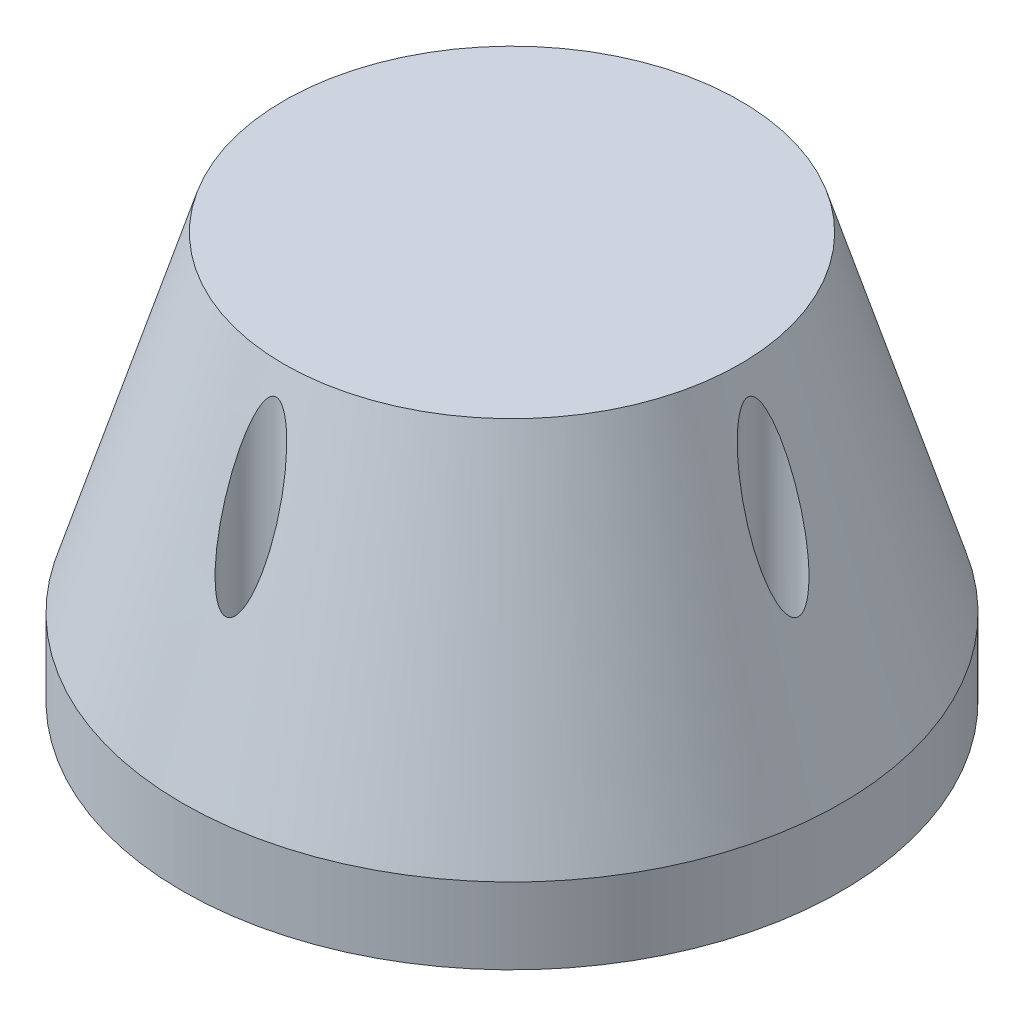
from build123d import *

# Parameters (mm, degrees)
SKETCH2_R          = 3
CUT_EXTRUDE1_DEPTH = 122.86057607
SKETCH2_3_R        = 5
SKETCH2_3_R_2      = 3
CUT_EXTRUDE2_DEPTH = 45


with BuildPart() as part:
    # Sketch1 → Revolve1 (revolve)
    with BuildSketch(Plane(origin=(0, 0, 0), x_dir=(0, 0, -1), z_dir=(1, 0, 0))):
        Polygon((0, 0), (-65, 0), (-65, 15), (-45, 80), (0, 80), align=None)
    revolve(axis=Axis((0, 80, 0), (0, -1, 0)))

    # Sketch2 → Cut-Extrude1 (cut, through all)
    with BuildSketch(Plane(origin=(0, 80, 0), x_dir=(1, 0, 0), z_dir=(0, 1, 0))):
        with Locations((-51.5, 0)):
            Circle(SKETCH2_R)
        with Locations((0, 51.5)):
            Circle(SKETCH2_R)
        with Locations((51.5, 0)):
            Circle(SKETCH2_R)
        with Locations((0, -51.5)):
            Circle(SKETCH2_R)
    extrude(amount=-CUT_EXTRUDE1_DEPTH, mode=Mode.SUBTRACT)

    # Sketch2<3> → Cut-Extrude2 (cut)
    # profile 1 of 4: a face of its own
    with BuildSketch(Plane(origin=(0, 80, 0), x_dir=(1, 0, 0), z_dir=(0, 1, 0))):
        with Locations((-51.5, 0)):
            Circle(SKETCH2_3_R)
        with Locations((-51.5, 0)):
            Circle(SKETCH2_3_R_2, mode=Mode.SUBTRACT)
    # profile 2 of 4: a face of its own
    with BuildSketch(Plane(origin=(0, 80, 0), x_dir=(1, 0, 0), z_dir=(0, 1, 0))):
        with Locations((0, 51.5)):
            Circle(SKETCH2_3_R)
        with Locations((0, 51.5)):
            Circle(SKETCH2_3_R_2, mode=Mode.SUBTRACT)
    # profile 3 of 4: a face of its own
    with BuildSketch(Plane(origin=(0, 80, 0), x_dir=(1, 0, 0), z_dir=(0, 1, 0))):
        with Locations((51.5, 0)):
            Circle(SKETCH2_3_R)
        with Locations((51.5, 0)):
            Circle(SKETCH2_3_R_2, mode=Mode.SUBTRACT)
    # profile 4 of 4: a face of its own
    with BuildSketch(Plane(origin=(0, 80, 0), x_dir=(1, 0, 0), z_dir=(0, 1, 0))):
        with Locations((0, -51.5)):
            Circle(SKETCH2_3_R)
        with Locations((0, -51.5)):
            Circle(SKETCH2_3_R_2, mode=Mode.SUBTRACT)
    extrude(amount=-CUT_EXTRUDE2_DEPTH, mode=Mode.SUBTRACT)


solid = part.part
